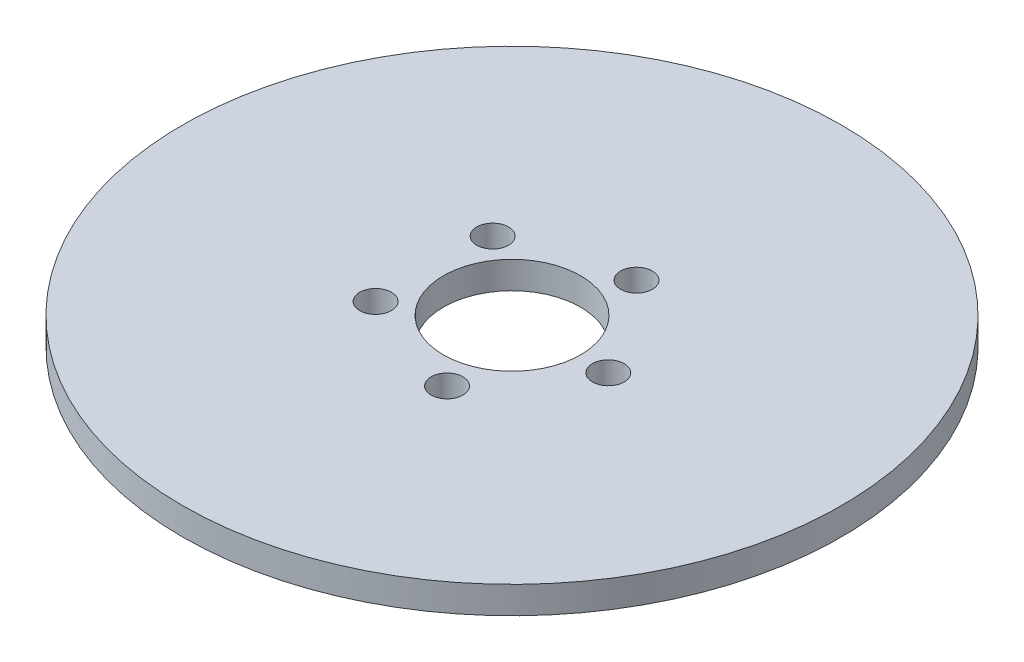
from build123d import *

# Parameters (mm, degrees)
SKETCH1_R           = 38.45
SKETCH1_R_2         = 8.001
SKETCH1_R_3         = 1.8542
BOSS_EXTRUDE1_DEPTH = 3.175


with BuildPart() as part:
    # Sketch1 → Boss-Extrude1 (new body)
    with BuildSketch(Plane(origin=(0, 1054.463973352, 0), x_dir=(-1, 0, 0), z_dir=(0, 1, 0))):
        with Locations((1.204093701, -633.11487505)):
            Circle(SKETCH1_R)
        with Locations((1.204093701, -633.11487505)):
            Circle(SKETCH1_R_2, mode=Mode.SUBTRACT)
        with Locations((10.336534073, -639.988260885)):
            Circle(SKETCH1_R_3, mode=Mode.SUBTRACT)
        with Locations((-2.510805411, -643.924335008)):
            Circle(SKETCH1_R_3, mode=Mode.SUBTRACT)
        with Locations((-10.224280588, -632.922102869)):
            Circle(SKETCH1_R_3, mode=Mode.SUBTRACT)
        with Locations((10.563151363, -626.553401155)):
            Circle(SKETCH1_R_3, mode=Mode.SUBTRACT)
        with Locations((-2.144130934, -622.186275332)):
            Circle(SKETCH1_R_3, mode=Mode.SUBTRACT)
    extrude(amount=-BOSS_EXTRUDE1_DEPTH)


solid = part.part
